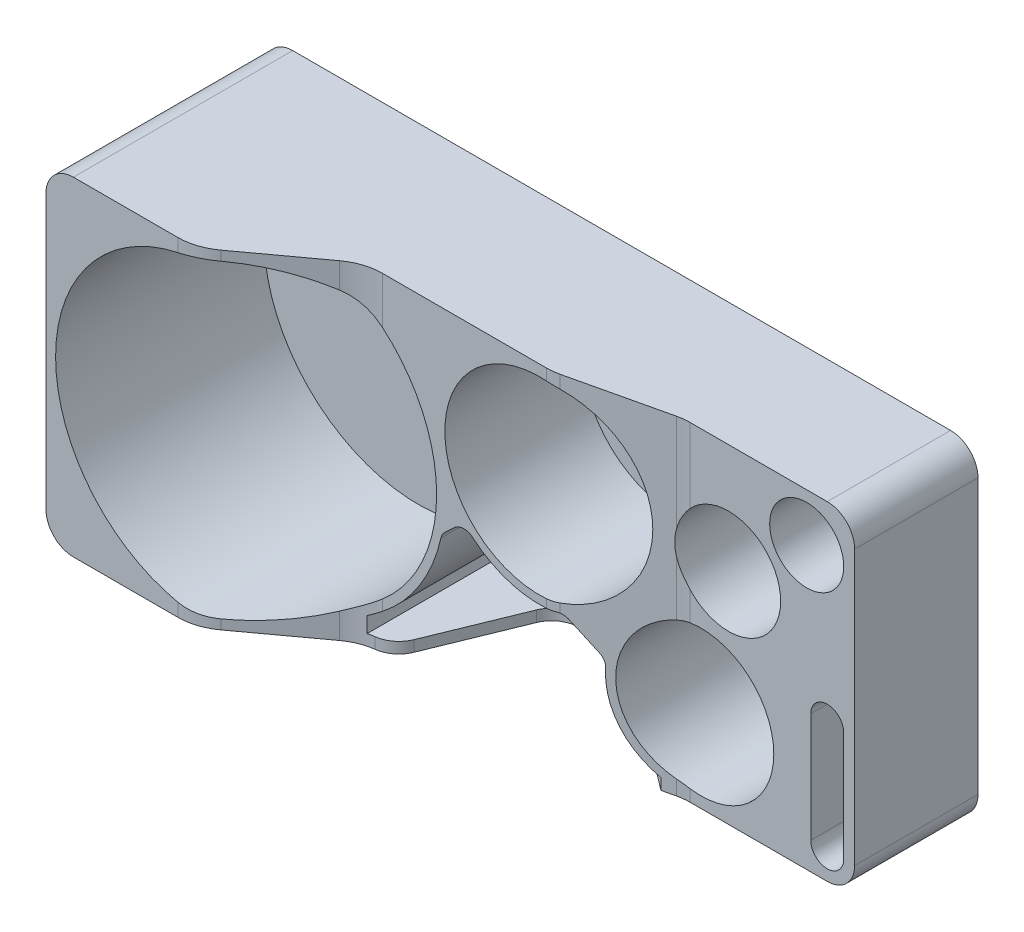
from build123d import *

# Parameters (mm, degrees)
SKETCH1_W               = 60
SKETCH1_H               = 130
BOSS_EXTRUDE1_DEPTH     = 40
SKETCH2_R               = 28.25
SKETCH2_R_2             = 13.25
SKETCH2_R_3             = 17.25
SKETCH2_R_4             = 6.75
SKETCH2_R_5             = 9.5
CUT_EXTRUDE1_DEPTH      = 38
CUT_EXTRUDE9_DEPTH      = 83.006097334
CUT_EXTRUDE9_DEPTH_BACK = 83.006097334
CUT_EXTRUDE10_START     = 2
CUT_EXTRUDE10_DEPTH     = 81.006097334
CUT_EXTRUDE11_REACH     = 99.082
FILLET8_R               = 5
FILLET9_R               = 10
FILLET10_R              = 2.5
FILLET11_R              = 5


with BuildPart() as part:
    # Sketch1 → Boss-Extrude1 (new body)
    with BuildSketch(Plane(origin=(0, 0, 0), x_dir=(0, 1, 0), z_dir=(0, 0, 1))):
        Rectangle(SKETCH1_W, SKETCH1_H)
    extrude(amount=BOSS_EXTRUDE1_DEPTH)

    # Sketch2 → Cut-Extrude1 (cut)
    with BuildSketch(Plane.XY.offset(40)):
        with Locations((-35, 0)):
            Circle(SKETCH2_R)
        with Locations((37, -14.75)):
            Circle(SKETCH2_R_2)
        with Locations((12, 10.75)):
            Circle(SKETCH2_R_3)
        with Locations((56.25, 21.25)):
            Circle(SKETCH2_R_4)
        with Locations((42, 10)):
            Circle(SKETCH2_R_5)
        with BuildLine():
            Line((63, -5), (63, -25))
            ThreePointArc((63, -25), (60, -28), (57, -25))
            Line((57, -25), (57, -5))
            ThreePointArc((57, -5), (60, -2), (63, -5))
        make_face()
    extrude(amount=-CUT_EXTRUDE1_DEPTH, mode=Mode.SUBTRACT)

    # Sketch11 → Cut-Extrude9 (cut, two sides: drawn at the far end of the back side and taken through both)
    with BuildSketch(Plane(origin=(0, 0, 0), x_dir=(-1, 0, 0), z_dir=(0, 1, 0)).offset(-CUT_EXTRUDE9_DEPTH_BACK)):
        Polygon((37.662617959, 40), (-65, 40), (-65, 22.5), (-33.857500095, 22.5), (-14.42300462, 27), (19.914447088, 27), align=None)
    extrude(amount=CUT_EXTRUDE9_DEPTH + CUT_EXTRUDE9_DEPTH_BACK, mode=Mode.SUBTRACT)

    # Sketch12 → Cut-Extrude10 (cut, through all)
    with BuildSketch(Plane(origin=(0, 0, 0), x_dir=(0, 1, 0), z_dir=(0, 0, 1)).offset(CUT_EXTRUDE10_START)):
        with BuildLine():
            Line((-25.153127982, 19.113444278), (-28, 19.113444278))
            Line((-28, 19.113444278), (-28, -14.42300462))
            Line((-28, -14.42300462), (-28, -30.519259302))
            ThreePointArc((-28, -30.519259302), (-21.630520462, -23.953125349), (-12.614481333, -22.405409906))
            Line((-12.614481333, -22.405409906), (-7.568879853, -15.997641924))
            ThreePointArc((-7.568879853, -15.997641924), (-7.137176738, -6.377597635), (-1.98737408, 1.759425917))
            Line((-1.98737408, 1.759425917), (-5.735279815, 5.808065062))
            ThreePointArc((-5.735279815, 5.808065062), (-16.816114685, 10.458590364), (-25.153127982, 19.113444278))
        make_face()
    extrude(amount=CUT_EXTRUDE10_DEPTH, mode=Mode.SUBTRACT)

    # Sketch13 → Cut-Extrude11 (cut, up to next)
    with BuildSketch(Plane.XZ.offset(30), mode=Mode.PRIVATE) as cut_extrude11_sk1:
        Polygon((-15.112535459, 27), (35.351266766, 27), (6.364131369, 5), (-6.135868631, 5), align=None)
    cut_extrude11_tool1 = extrude(cut_extrude11_sk1.sketch, amount=-CUT_EXTRUDE11_REACH, mode=Mode.PRIVATE) & part.part
    add(cut_extrude11_tool1.solids().sort_by_distance((6.122185, -30, 18.210804))[0], mode=Mode.SUBTRACT)

    # Fillet8
    fillet8_edges = [part.edges().sort_by_distance(p)[0] for p in [
        (65, 30, 11.25),
        (65, -30, 11.25),
        (-65, -30, 20),
        (-65, 30, 20),
    ]]
    fillet(fillet8_edges, radius=FILLET8_R)

    # Fillet9
    # the kernel refuses this fillet: 10 mm, written as the material it adds along each edge
    with BuildSketch(Plane(origin=(33.857500095, -30, 22.5), x_dir=(1, 0, 0), z_dir=(0, 1, 0))) as fillet9_piece_1_section:
        with BuildLine():
            CenterArc((FILLET9_R * 0.114262005899, -FILLET9_R), FILLET9_R, 90, 13.036921742)
            Line((-FILLET9_R * 0.111316891577, -FILLET9_R * 0.0257750973141), (0, 0))
            Line((0, 0), (FILLET9_R * 0.114262005899, 0))
        make_face()
    fillet9_piece_1 = extrude(amount=5.234596359, mode=Mode.PRIVATE)
    fillet9_piece_1 = fillet9_piece_1 - Plane(origin=(37, -14.75, 22.477974756), x_dir=(1, 0, 0), z_dir=(0, 0, 1)) * Cylinder(13.25, 16, mode=Mode.PRIVATE)
    add(fillet9_piece_1)
    with BuildSketch(Plane(origin=(33.857500095, -4.734596359, 22.5), x_dir=(1, 0, 0), z_dir=(0, 1, 0))) as fillet9_piece_2_section:
        with BuildLine():
            CenterArc((FILLET9_R * 0.114262005899, -FILLET9_R), FILLET9_R, 90, 13.036921742)
            Line((-FILLET9_R * 0.111316891577, -FILLET9_R * 0.0257750973141), (0, 0))
            Line((0, 0), (FILLET9_R * 0.114262005899, 0))
        make_face()
    fillet9_piece_2 = extrude(amount=12.697303917, mode=Mode.PRIVATE)
    fillet9_piece_2 = fillet9_piece_2 - Plane(origin=(37, -14.75, 22.48681781), x_dir=(1, 0, 0), z_dir=(0, 0, 1)) * Cylinder(13.25, 30, mode=Mode.PRIVATE)
    fillet9_piece_2 = fillet9_piece_2 - Plane(origin=(42, 10, 22.48681781), x_dir=(1, 0, 0), z_dir=(0, 0, 1)) * Cylinder(9.5, 30, mode=Mode.PRIVATE)
    add(fillet9_piece_2)
    with BuildSketch(Plane(origin=(33.857500095, 12.037292442, 22.5), x_dir=(1, 0, 0), z_dir=(0, 1, 0))) as fillet9_piece_3_section:
        with BuildLine():
            CenterArc((FILLET9_R * 0.114262005899, -FILLET9_R), FILLET9_R, 90, 13.036921742)
            Line((-FILLET9_R * 0.111316891577, -FILLET9_R * 0.0257750973141), (0, 0))
            Line((0, 0), (FILLET9_R * 0.114262005899, 0))
        make_face()
    fillet9_piece_3 = extrude(amount=17.962707558, mode=Mode.PRIVATE)
    fillet9_piece_3 = fillet9_piece_3 - Plane(origin=(42, 10, 22.478816229), x_dir=(1, 0, 0), z_dir=(0, 0, 1)) * Cylinder(9.5, 41, mode=Mode.PRIVATE)
    add(fillet9_piece_3)
    with BuildSketch(Plane(origin=(-19.914447088, -15.708414802, 27), x_dir=(1, 0, 0), z_dir=(0, -1, 0))) as fillet9_piece_4_section:
        with BuildLine():
            CenterArc((FILLET9_R * 0.327059529607, FILLET9_R), FILLET9_R, 233.778347997, 36.221652003)
            Line((-FILLET9_R * 0.263851045123, FILLET9_R * 0.193262934611), (0, 0))
            Line((0, 0), (FILLET9_R * 0.327059529607, 0))
        make_face()
    fillet9_piece_4 = extrude(amount=14.291585198, mode=Mode.PRIVATE)
    fillet9_piece_4 = fillet9_piece_4 & Plane(origin=(-35, 0, 26.964300655), x_dir=(0.9812415105326922, -0.19278251478679478, 0), z_dir=(0, 0, -1)) * Cylinder(29.75, 42, mode=Mode.PRIVATE)
    fillet9_piece_4 = split(fillet9_piece_4, bisect_by=Plane(origin=(-19.113444278, -23.524724426, 26.964300655), z_dir=(1, 0, 0)), keep=Keep.TOP, mode=Mode.PRIVATE)
    fillet9_piece_4 = fillet9_piece_4 - Plane(origin=(-35, 0, 26.964300655), x_dir=(1, 0, 0), z_dir=(0, 0, 1)) * Cylinder(28.25, 42, mode=Mode.PRIVATE)
    add(fillet9_piece_4)
    with BuildSketch(Plane(origin=(-19.914447088, -15.708414802, 27), x_dir=(1, 0, 0), z_dir=(0, -1, 0))) as fillet9_piece_5_section:
        with BuildLine():
            CenterArc((FILLET9_R * 0.327059529607, FILLET9_R), FILLET9_R, 233.778347997, 36.221652003)
            Line((-FILLET9_R * 0.263851045123, FILLET9_R * 0.193262934611), (0, 0))
            Line((0, 0), (FILLET9_R * 0.327059529607, 0))
        make_face()
    fillet9_piece_5 = extrude(amount=14.291585198, mode=Mode.PRIVATE)
    fillet9_piece_5 = fillet9_piece_5 & Plane(origin=(-35, 0, 27.570308722), x_dir=(0.9812415105326922, -0.19278251478679478, 0), z_dir=(0, 0, -1)) * Cylinder(29.75, 42, mode=Mode.PRIVATE)
    fillet9_piece_5 = split(fillet9_piece_5, bisect_by=Plane(origin=(-19.113444278, -25.104682391, 27.570308722), z_dir=(-1, 0, 0)), keep=Keep.TOP, mode=Mode.PRIVATE)
    fillet9_piece_5 = fillet9_piece_5 - Plane(origin=(-35, 0, 27.570308722), x_dir=(1, 0, 0), z_dir=(0, 0, 1)) * Cylinder(28.25, 42, mode=Mode.PRIVATE)
    add(fillet9_piece_5)
    with BuildSketch(Plane(origin=(-19.914447088, -15.708414802, 27), x_dir=(1, 0, 0), z_dir=(0, -1, 0))) as fillet9_piece_6_section:
        with BuildLine():
            CenterArc((FILLET9_R * 0.327059529607, FILLET9_R), FILLET9_R, 233.778347997, 36.221652003)
            Line((-FILLET9_R * 0.263851045123, FILLET9_R * 0.193262934611), (0, 0))
            Line((0, 0), (FILLET9_R * 0.327059529607, 0))
        make_face()
    fillet9_piece_6 = extrude(amount=14.291585198, mode=Mode.PRIVATE)
    fillet9_piece_6 = fillet9_piece_6 - Plane(origin=(-35, 0, 27.459351012), x_dir=(0.9812415105326922, -0.19278251478679478, 0), z_dir=(0, 0, -1)) * Cylinder(29.75, 42, mode=Mode.PRIVATE)
    fillet9_piece_6 = split(fillet9_piece_6, bisect_by=Plane(origin=(-19.113444278, -26.928061773, 27.459351012), z_dir=(-1, 0, 0)), keep=Keep.TOP, mode=Mode.PRIVATE)
    fillet9_piece_6 = split(fillet9_piece_6, bisect_by=Plane(origin=(-20.316684316, -28, 27.459351012), z_dir=(0, 1, 0)), keep=Keep.TOP, mode=Mode.PRIVATE)
    add(fillet9_piece_6)
    with BuildSketch(Plane(origin=(-19.914447088, -15.708414802, 27), x_dir=(1, 0, 0), z_dir=(0, -1, 0))) as fillet9_piece_7_section:
        with BuildLine():
            CenterArc((FILLET9_R * 0.327059529607, FILLET9_R), FILLET9_R, 233.778347997, 36.221652003)
            Line((-FILLET9_R * 0.263851045123, FILLET9_R * 0.193262934611), (0, 0))
            Line((0, 0), (FILLET9_R * 0.327059529607, 0))
        make_face()
    fillet9_piece_7 = extrude(amount=14.291585198, mode=Mode.PRIVATE)
    fillet9_piece_7 = split(fillet9_piece_7, bisect_by=Plane(origin=(-19.113444278, -29, 26.965326642), z_dir=(1, 0, 0)), keep=Keep.TOP, mode=Mode.PRIVATE)
    fillet9_piece_7 = split(fillet9_piece_7, bisect_by=Plane(origin=(-18.088636338, -28, 26.965326642), z_dir=(0, -1, 0)), keep=Keep.TOP, mode=Mode.PRIVATE)
    add(fillet9_piece_7)
    with BuildSketch(Plane(origin=(-19.914447088, -15.708414802, 27), x_dir=(1, 0, 0), z_dir=(0, -1, 0))) as fillet9_piece_8_section:
        with BuildLine():
            CenterArc((FILLET9_R * 0.327059529607, FILLET9_R), FILLET9_R, 233.778347997, 36.221652003)
            Line((-FILLET9_R * 0.263851045123, FILLET9_R * 0.193262934611), (0, 0))
            Line((0, 0), (FILLET9_R * 0.327059529607, 0))
        make_face()
    fillet9_piece_8 = extrude(amount=14.291585198, mode=Mode.PRIVATE)
    fillet9_piece_8 = split(fillet9_piece_8, bisect_by=Plane(origin=(-19.113444278, -29, 27.580257853), z_dir=(-1, 0, 0)), keep=Keep.TOP, mode=Mode.PRIVATE)
    fillet9_piece_8 = split(fillet9_piece_8, bisect_by=Plane(origin=(-20.54645477, -28, 27.580257853), z_dir=(0, -1, 0)), keep=Keep.TOP, mode=Mode.PRIVATE)
    add(fillet9_piece_8)
    with BuildSketch(Plane(origin=(-19.914447088, 30, 27), x_dir=(-0.8067370653888534, 0, 0.5909105747300355), z_dir=(0, -1, 0))) as fillet9_piece_9_section:
        with BuildLine():
            CenterArc((FILLET9_R * 0.327059529607, -FILLET9_R), FILLET9_R, 90, 36.221652003)
            Line((-FILLET9_R * 0.263851045123, -FILLET9_R * 0.193262934611), (0, 0))
            Line((0, 0), (FILLET9_R * 0.327059529607, 0))
        make_face()
    fillet9_piece_9 = extrude(amount=14.291585198, mode=Mode.PRIVATE)
    fillet9_piece_9 = fillet9_piece_9 - Plane(origin=(-35, 0, 27.325753935), x_dir=(1, 0, 0), z_dir=(0, 0, 1)) * Cylinder(28.25, 42, mode=Mode.PRIVATE)
    add(fillet9_piece_9)
    # the kernel refuses this fillet: 10 mm, written as the material it takes off along each edge
    with BuildSketch(Plane(origin=(14.42300462, 32.856550147, 27), x_dir=(0.9742249026859169, 0, -0.22557889747628432), z_dir=(0, -1, 0))) as fillet9_2_piece_1:
        with BuildLine():
            CenterArc((FILLET9_R * 0.114262005899, -FILLET9_R), FILLET9_R, 90, 13.036921742)
            Line((-FILLET9_R * 0.111316891577, -FILLET9_R * 0.0257750973141), (0, 0))
            Line((0, 0), (FILLET9_R * 0.114262005899, 0))
        make_face()
    extrude(amount=7.884120565, mode=Mode.SUBTRACT)
    with BuildSketch(Plane(origin=(14.42300462, -3.472429582, 27), x_dir=(0.9742249026859169, 0, -0.22557889747628432), z_dir=(0, -1, 0))) as fillet9_2_piece_2:
        with BuildLine():
            CenterArc((FILLET9_R * 0.114262005899, -FILLET9_R), FILLET9_R, 90, 13.036921742)
            Line((-FILLET9_R * 0.111316891577, -FILLET9_R * 0.0257750973141), (0, 0))
            Line((0, 0), (FILLET9_R * 0.114262005899, 0))
        make_face()
    extrude(amount=7.226902729, mode=Mode.SUBTRACT)
    with BuildSketch(Plane(origin=(-37.662617959, 38.17648824, 40), x_dir=(0.8067370653888553, 0, -0.5909105747300331), z_dir=(0, -1, 0)), Plane(origin=(-37.662617959, -19.94775336, 40), x_dir=(0.8067370653888553, 0, -0.5909105747300331), z_dir=(0, -1, 0))) as fillet9_2_piece_3:
        with BuildLine():
            CenterArc((FILLET9_R * 0.327059529607, -FILLET9_R), FILLET9_R, 90, 36.221652003)
            Line((-FILLET9_R * 0.263851045123, -FILLET9_R * 0.193262934611), (0, 0))
            Line((0, 0), (FILLET9_R * 0.327059529607, 0))
        make_face()
    extrude(amount=18.22873488, mode=Mode.SUBTRACT)

    # Fillet10
    fillet10_edges = [part.edges().sort_by_distance(p)[0] for p in [
        (22.405409906, -12.614481333, 13.575848822),
        (15.997641924, -7.568879853, 14.317698693),
        (-1.759425917, -1.98737408, 14.5),
        (-5.808065062, -5.735279815, 14.5),
    ]]
    fillet(fillet10_edges, radius=FILLET10_R)

    # Fillet11
    fillet11_edges = [part.edges().sort_by_distance(p)[0] for p in [
        (6.364131369, -29, 5),
        (-6.135868631, -29, 5),
        (-15.112535459, -29, 27),
    ]]
    fillet(fillet11_edges, radius=FILLET11_R)


solid = part.part
